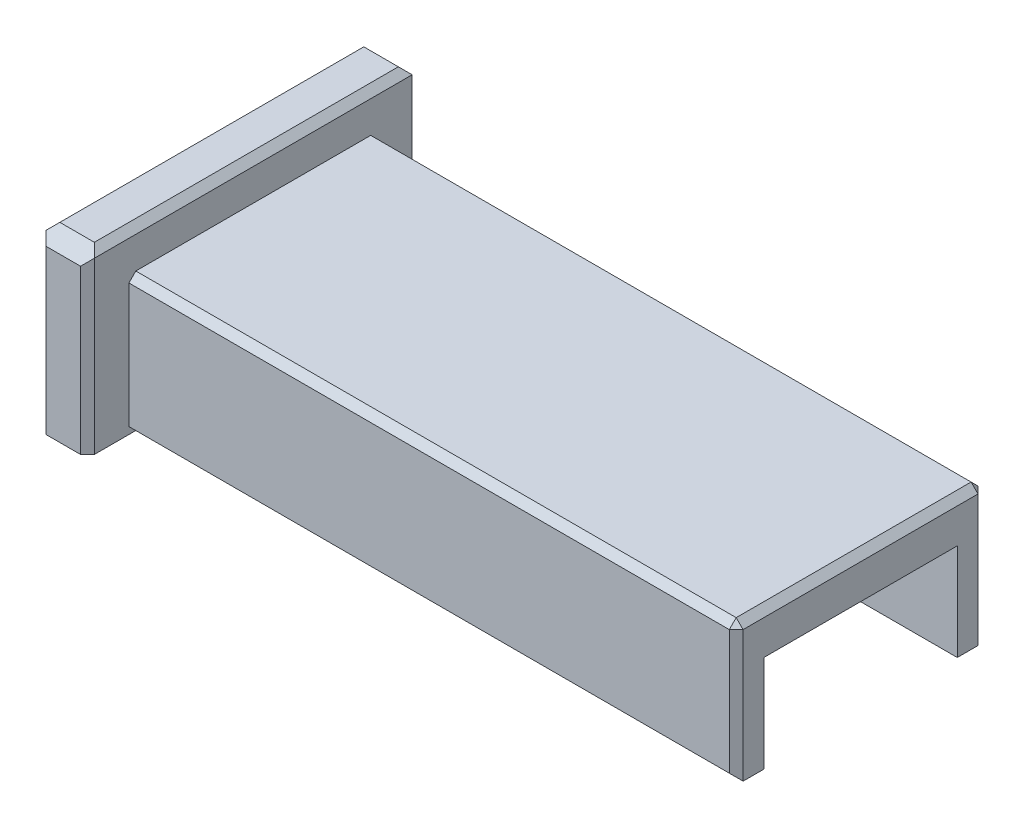
from build123d import *

# Parameters (mm, degrees)
SKETCH_1_W          = 47.45
SKETCH_1_H          = 18
EXTRUDE_1_DEPTH     = 10
SKETCH_2_W          = 24
SKETCH_2_H          = 12.8
EXTRUDE_2_DEPTH     = 3.5
SKETCH_3_W          = 14
SKETCH_3_H          = 7
CUT_EXTRUDE_1_DEPTH = 47.45
CHAMFER_1_SIZE      = 1
CHAMFER_2_SIZE      = 0.5


with BuildPart() as part:
    # 草图1 → 凸台-拉伸1 (new body)
    with BuildSketch(Plane(origin=(0, 0, 0), x_dir=(1, 0, 0), z_dir=(0, 1, 0))):
        Rectangle(SKETCH_1_W, SKETCH_1_H)
    extrude(amount=EXTRUDE_1_DEPTH)

    # 草图2 → 凸台-拉伸2 (add)
    with BuildSketch(Plane.ZY.offset(23.725)):
        with Locations((0, 6.4)):
            Rectangle(SKETCH_2_W, SKETCH_2_H)
    extrude(amount=-EXTRUDE_2_DEPTH)

    # 草图3 → 切除-拉伸1 (cut)
    with BuildSketch(Plane.ZY.offset(23.725)):
        with Locations((0, 3.5)):
            Rectangle(SKETCH_3_W, SKETCH_3_H)
    extrude(amount=-CUT_EXTRUDE_1_DEPTH, mode=Mode.SUBTRACT)

    # 倒角1
    chamfer_1_edges = [part.edges().sort_by_distance(p)[0] for p in [
        (-21.975, 12.8, -12),
        (-21.975, 12.8, 12),
    ]]
    chamfer(chamfer_1_edges, length=CHAMFER_1_SIZE)

    # 倒角2
    chamfer_2_edges = [part.edges().sort_by_distance(p)[0] for p in [
        (1.75, 0, 9),
        (1.75, 0, -9),
        (1.75, 10, -9),
        (1.75, 10, 9),
        (23.725, 5, -9),
        (23.725, 10, 0),
        (23.725, 5, 9),
        (-20.225, 5.9, -12),
        (-20.225, 12.8, 0),
        (-20.225, 5.9, 12),
        (-23.725, 12.8, 0),
        (-23.725, 5.9, -12),
        (-23.725, 5.9, 12),
        (-23.725, 3.5, 7),
        (-23.725, 7, 0),
        (-23.725, 3.5, -7),
    ]]
    chamfer(chamfer_2_edges, length=CHAMFER_2_SIZE - 0.0001)  # a hair under: the kernel refuses the full size


solid = part.part
